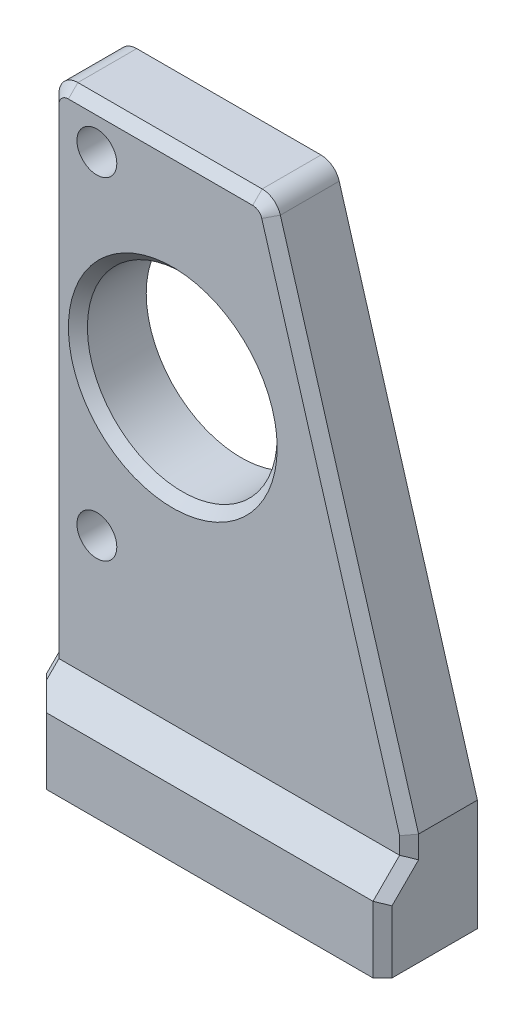
from build123d import *

# Parameters (mm, degrees)
SKIZZE1_R                            = 2.1
AUFSATZ_LINEAR_AUSTRAGEN1_DEPTH      = 10
SKIZZE2_R                            = 1.5
SCHNITT_LINEAR_AUSTRAGEN1_DEPTH      = 8
SCHNITT_LINEAR_AUSTRAGEN3_DEPTH      = 2.8
SCHNITT_LINEAR_AUSTRAGEN5_DEPTH      = 69.862823313
SCHNITT_LINEAR_AUSTRAGEN5_DEPTH_BACK = 69.862823313
SKIZZE7_R                            = 10
FASE1_SIZE                           = 3
SCHNITT_LINEAR_AUSTRAGEN4_DEPTH      = 10
VERRUNDUNG1_R                        = 2
FASE2_SIZE                           = 1
FASE3_SIZE                           = 2.5
SKIZZE8_R                            = 3.6
SCHNITT_LINEAR_AUSTRAGEN6_DEPTH      = 3
FASE4_SIZE                           = 0.6


with BuildPart() as part:
    # Skizze1 → Aufsatz-Linear austragen1 (new body)
    with BuildSketch(Plane.XY):
        Polygon((28.287001282, 57.370618027), (28.287001282, 0), (-13.088781156, 0), (-13.088781156, 27.348243657), (-13.088781156, 53.715647777), (-13.088781156, 57.370618027), (-13.088781156, 62.370618027), (28.287001282, 62.370618027), align=None)
        with Locations((-8.088781156, 23.031945717)):
            Circle(SKIZZE1_R, mode=Mode.SUBTRACT)
        with Locations(Location((-8.088781156, 58.031945717, 0), (0, 0, 180))):
            Circle(SKIZZE1_R, mode=Mode.SUBTRACT)
    extrude(amount=AUFSATZ_LINEAR_AUSTRAGEN1_DEPTH)

    # Skizze2 → Schnitt-Linear austragen1 (cut)
    with BuildSketch(Plane.XZ):
        with Locations((-7, 5)):
            Circle(SKIZZE2_R)
        with Locations((6.18, 5)):
            Circle(SKIZZE2_R)
        with Locations((19.36, 5)):
            Circle(SKIZZE2_R)
    extrude(amount=-SCHNITT_LINEAR_AUSTRAGEN1_DEPTH, mode=Mode.SUBTRACT)

    # Skizze4 → Schnitt-Linear austragen3 (cut)
    with BuildSketch(Plane.XY.offset(10)):
        Polygon((-15.095168359, 10), (28.287001282, 10), (36.093332102, 46.989971623), (30.429094825, 65.957451721), (-16.081030445, 65.957451721), (-16.081030445, 27.753515123), align=None)
    extrude(amount=-SCHNITT_LINEAR_AUSTRAGEN3_DEPTH, mode=Mode.SUBTRACT)

    # Skizze7 → Schnitt-Linear austragen5 (cut, two sides: drawn at the far end of the back side and taken through both)
    with BuildSketch(Plane.XY.offset(7.2).offset(-SCHNITT_LINEAR_AUSTRAGEN5_DEPTH_BACK)):
        with Locations((-0.088781156, 40.531945717)):
            Circle(SKIZZE7_R)
    extrude(amount=SCHNITT_LINEAR_AUSTRAGEN5_DEPTH + SCHNITT_LINEAR_AUSTRAGEN5_DEPTH_BACK, mode=Mode.SUBTRACT)

    # Fase1
    # the kernel refuses this chamfer: 3 mm, written as the material it takes off along each edge
    with BuildSketch(Plane(origin=(-20.80383012, 10, 10), x_dir=(0, -0.9996219169112969, 0.027495876610586202), z_dir=(1, 0, 0))) as fase1_piece_1_section:
        Polygon((FASE1_SIZE * 0.999621916911, FASE1_SIZE * 0.0274958766106), (-FASE1_SIZE * 0.0274958766106, FASE1_SIZE * 0.999621916911), (0, 0), align=None)
    fase1_piece_1 = extrude(amount=56.805880365, mode=Mode.PRIVATE)
    fase1_piece_1 = split(fase1_piece_1, bisect_by=Plane(origin=(7.599110063, 8.999392985, 7.2), z_dir=(0, 0, 1)), keep=Keep.TOP, mode=Mode.PRIVATE)
    add(fase1_piece_1, mode=Mode.SUBTRACT)

    # Skizze5 → Schnitt-Linear austragen4 (cut)
    with BuildSketch(Plane(origin=(0, 0, 0), x_dir=(-1, 0, 0), z_dir=(0, 0, -1))):
        Polygon((-24.81273389, 11.736777957), (-9.824335871, 62.370618027), (-28.287001282, 62.370618027), (-28.287001282, 0), (-24.81273389, 0), align=None)
    extrude(amount=-SCHNITT_LINEAR_AUSTRAGEN4_DEPTH, mode=Mode.SUBTRACT)

    # Verrundung1
    verrundung1_edges = [part.edges().sort_by_distance(p)[0] for p in [
        (9.824335871, 62.370618027, 3.6),
        (-13.088781156, 62.370618027, 3.6),
    ]]
    fillet(verrundung1_edges, radius=VERRUNDUNG1_R)

    # Fase2
    fase2_edges = [part.edges().sort_by_distance(p)[0] for p in [
        (24.81273389, 10.768388979, 7.2),
        (24.81273389, 3.5, 10),
        (-13.088781156, 35.085309014, 7.2),
        (-1.379099888, 62.370618027, 7.2),
        (17.530529072, 36.337538735, 7.2),
        (9.527376482, 61.973016693, 7.2),
        (-12.502994718, 61.78483159, 7.2),
        (-10.088781156, 40.531945717, 7.2),
        (-13.088781156, 8.4, 8.6),
        (24.81273389, 8.4, 8.6),
    ]]
    chamfer(fase2_edges, length=FASE2_SIZE)

    # Fase3
    fase3_edges = [part.edges().sort_by_distance(p)[0] for p in [
        (-13.088781156, 2.792893219, 10),
    ]]
    chamfer(fase3_edges, length=FASE3_SIZE)

    # Skizze8 → Schnitt-Linear austragen6 (cut)
    with BuildSketch(Plane(origin=(0, 0, 0), x_dir=(-1, 0, 0), z_dir=(0, 0, -1))):
        with Locations((8.088781156, 23.031945717)):
            Circle(SKIZZE8_R)
    extrude(amount=-SCHNITT_LINEAR_AUSTRAGEN6_DEPTH, mode=Mode.SUBTRACT)

    # Fase4
    fase4_edges = [part.edges().sort_by_distance(p)[0] for p in [
        (-10.188781156, 23.031945717, 3),
    ]]
    chamfer(fase4_edges, length=FASE4_SIZE)


solid = part.part
